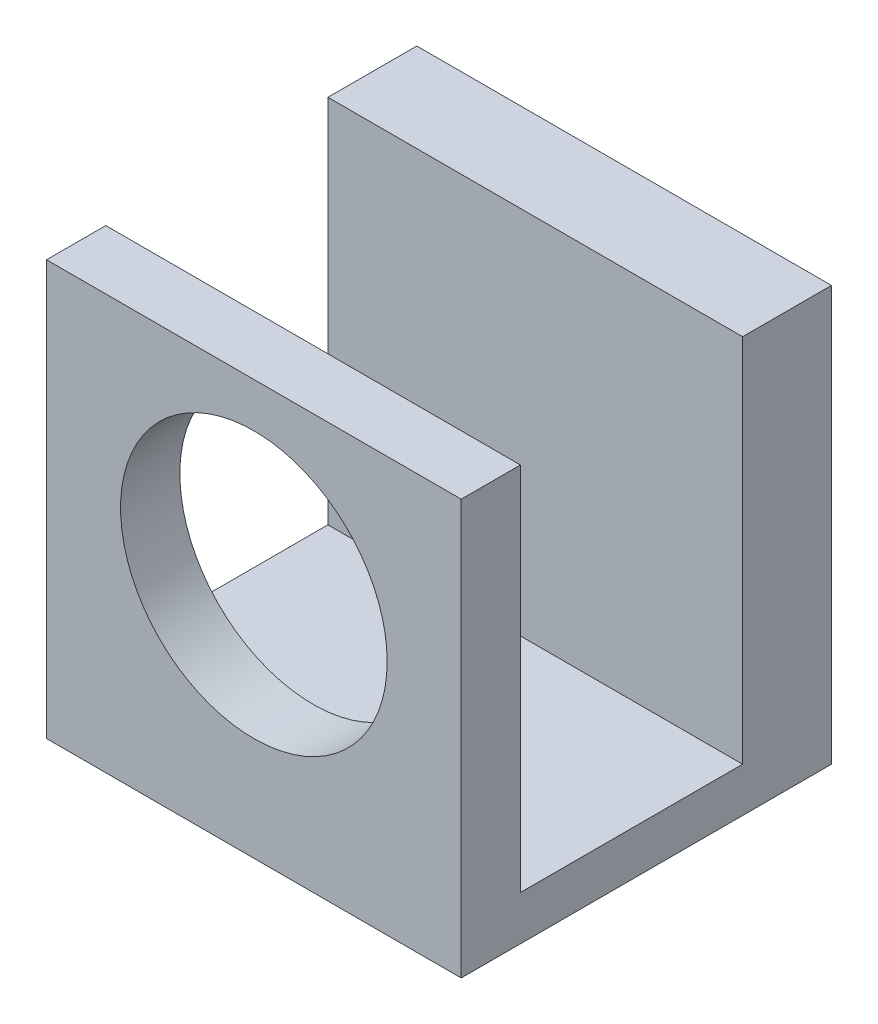
from build123d import *

# Parameters (mm, degrees)
SKETCH1_W           = 7.112
SKETCH1_H           = 6.35
BOSS_EXTRUDE1_DEPTH = 7.112
SKETCH2_R           = 2.286
CUT_EXTRUDE1_DEPTH  = 1.27
SKETCH3_W           = 11.43
SKETCH3_H           = 3.81
CUT_EXTRUDE2_DEPTH  = 6.35


with BuildPart() as part:
    # Sketch1 → Boss-Extrude1 (new body)
    with BuildSketch(Plane(origin=(0, 0, 0), x_dir=(1, 0, 0), z_dir=(0, 1, 0))):
        with Locations((3.556, 3.175)):
            Rectangle(SKETCH1_W, SKETCH1_H)
    extrude(amount=BOSS_EXTRUDE1_DEPTH)

    # Sketch2 → Cut-Extrude1 (cut)
    with BuildSketch(Plane.XY):
        with Locations((3.556, 4.064)):
            Circle(SKETCH2_R)
    extrude(amount=-CUT_EXTRUDE1_DEPTH, mode=Mode.SUBTRACT)

    # Sketch3 → Cut-Extrude2 (cut)
    with BuildSketch(Plane(origin=(0, 7.112, 0), x_dir=(1, 0, 0), z_dir=(0, 1, 0))):
        with Locations((3.175, 2.921)):
            Rectangle(SKETCH3_W, SKETCH3_H)
    extrude(amount=-CUT_EXTRUDE2_DEPTH, mode=Mode.SUBTRACT)


solid = part.part
